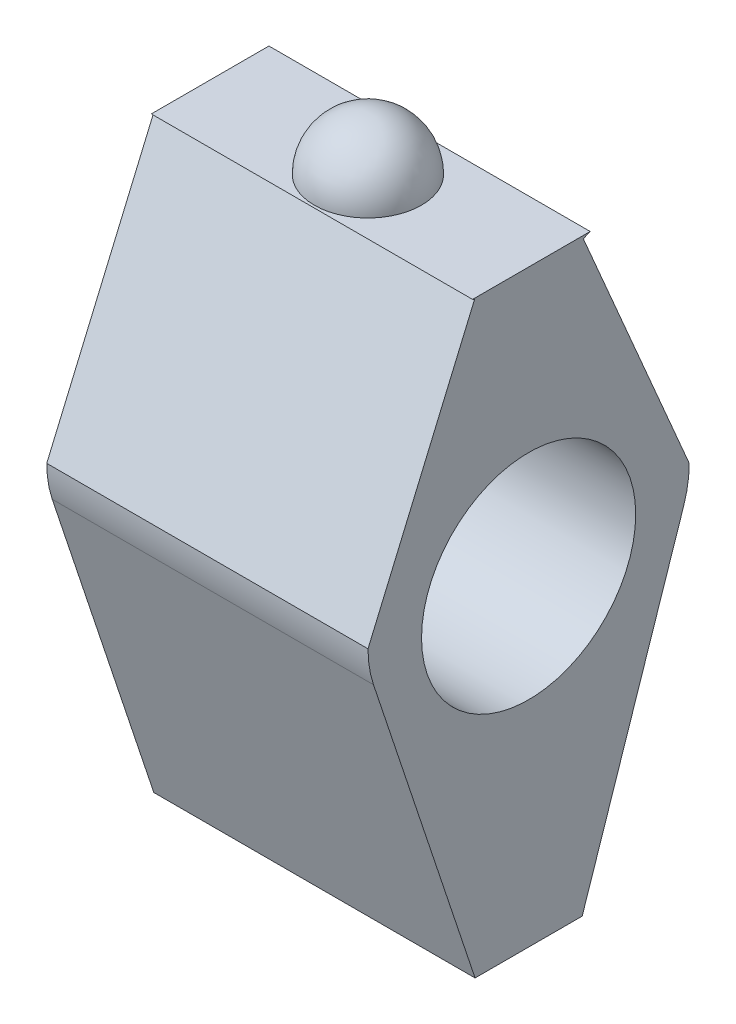
from build123d import *

# Parameters (mm, degrees)
SKETCH1_W           = 76.2
SKETCH1_H           = 152.4
BOSS_EXTRUDE1_DEPTH = 76.2
SKETCH2_R           = 25.4
CUT_EXTRUDE1_DEPTH  = 101.6
CUT_EXTRUDE2_DEPTH  = 132.982271537
FILLET1_R           = 25.4
SKETCH4_W           = 76.2
SKETCH4_H           = 76.2
SKETCH4_R           = 12.7
CUT_EXTRUDE3_DEPTH  = 12.7
FILLET2_R           = 12.7
SKETCH6_W           = 83.912866254
SKETCH6_H           = 103.792472971
CUT_EXTRUDE4_DEPTH  = 25.4
SKETCH7_W           = 80.804571494
SKETCH7_H           = 97.595131804
CUT_EXTRUDE5_DEPTH  = 25.4


with BuildPart() as part:
    # Sketch1 → Boss-Extrude1 (new body)
    with BuildSketch(Plane.XY):
        Rectangle(SKETCH1_W, SKETCH1_H)
    extrude(amount=BOSS_EXTRUDE1_DEPTH)

    # Sketch2 → Cut-Extrude1 (cut)
    with BuildSketch(Plane(origin=(38.1, 0, 0), x_dir=(0, 0, -1), z_dir=(1, 0, 0))):
        with Locations((-38.1, 0)):
            Circle(SKETCH2_R)
    extrude(amount=-CUT_EXTRUDE1_DEPTH, mode=Mode.SUBTRACT)

    # Sketch3 → Cut-Extrude2 (cut, through all)
    with BuildSketch(Plane(origin=(38.1, 0, 0), x_dir=(0, 0, -1), z_dir=(1, 0, 0))):
        Polygon((-76.2, 0), (-50.8, -76.2), (-76.2, -76.2), align=None)
        Polygon((0, 0), (-25.4, -76.2), (0, -76.2), align=None)
    extrude(amount=-CUT_EXTRUDE2_DEPTH, mode=Mode.SUBTRACT)

    # Fillet1
    fillet1_edges = [part.edges().sort_by_distance(p)[0] for p in [
        (0, 0, 76.2),
        (0, 0, 0),
    ]]
    fillet(fillet1_edges, radius=FILLET1_R)

    # Sketch4 → Cut-Extrude3 (cut)
    with BuildSketch(Plane(origin=(0, 76.2, 0), x_dir=(1, 0, 0), z_dir=(0, 1, 0))):
        with Locations((0, -38.1)):
            Rectangle(SKETCH4_W, SKETCH4_H)
        with Locations(Location((0, -38.123369208, 0), (0, 0, 270))):
            Circle(SKETCH4_R, mode=Mode.SUBTRACT)
    extrude(amount=-CUT_EXTRUDE3_DEPTH, mode=Mode.SUBTRACT)

    # Fillet2
    fillet2_edges = [part.edges().sort_by_distance(p)[0] for p in [
        (0, 76.2, 25.423369208),
    ]]
    fillet(fillet2_edges, radius=FILLET2_R - 0.0001)  # a hair under: the kernel refuses the full size

    # Sketch6 → Cut-Extrude4 (cut)
    with BuildSketch(Plane(origin=(0, 28.172957058, 65.921201736), x_dir=(-1, 0, 0), z_dir=(0, -0.3929882709190667, -0.9195434839745439))):
        with Locations((0.104629509, -13.705043198)):
            Rectangle(SKETCH6_W, SKETCH6_H)
    extrude(amount=-CUT_EXTRUDE4_DEPTH, mode=Mode.SUBTRACT)

    # Sketch7 → Cut-Extrude5 (cut)
    with BuildSketch(Plane(origin=(0, 0.638561447, -1.491407194), x_dir=(-1, 0, 0), z_dir=(0, 0.39360002771646513, -0.9192817947624101))):
        with Locations((0.629646012, 18.826047721)):
            Rectangle(SKETCH7_W, SKETCH7_H)
    extrude(amount=CUT_EXTRUDE5_DEPTH, mode=Mode.SUBTRACT)


solid = part.part
